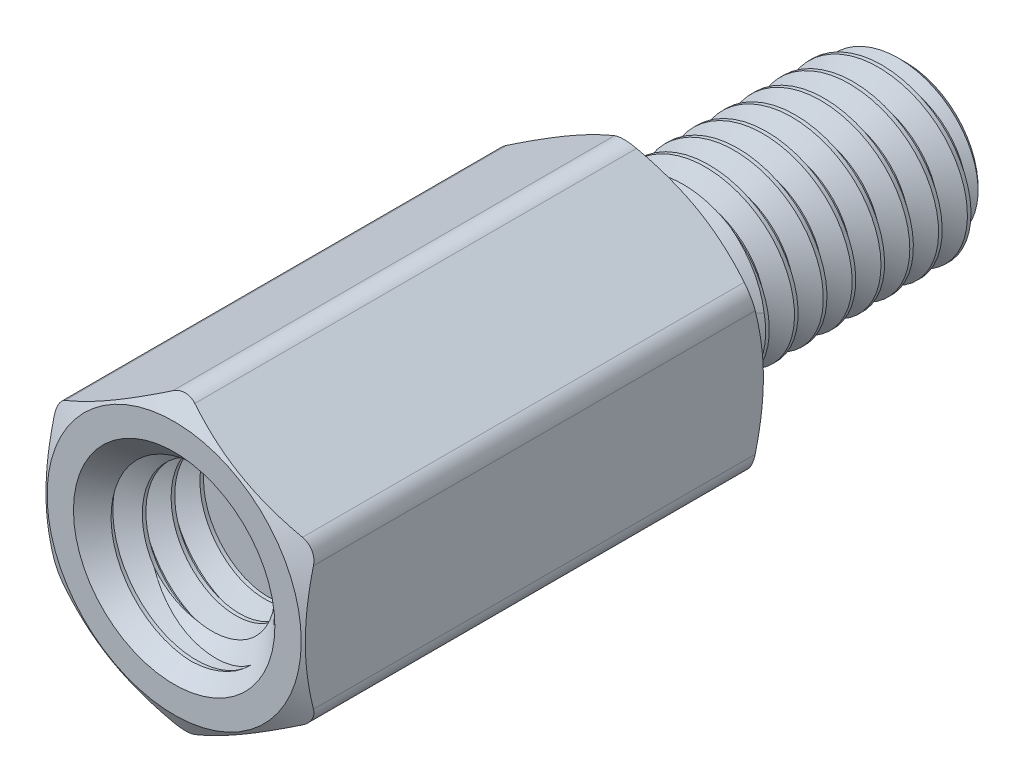
from build123d import *

# Parameters (mm, degrees)
SKETCH4_R           = 1.875
BOSS_EXTRUDE1_DEPTH = 8
SKETCH5_OUTSIDE_W   = 58.428
SKETCH5_OUTSIDE_H   = 59.124
SKETCH5_OUTSIDE_R   = 2.205
CUT_EXTRUDE1_DEPTH  = 14.156842326
CUT_EXTRUDE1_DRAFT  = -60
SKETCH6_OUTSIDE_W   = 43.014
SKETCH6_OUTSIDE_H   = 43.71
SKETCH6_OUTSIDE_R   = 2.205
CUT_EXTRUDE2_DEPTH  = 9.707037384
CUT_EXTRUDE2_DRAFT  = -60
FILLET1_R           = 0.3825
CUT_SWEEP1_PITCH    = 0.5
SKETCH9_R           = 1.75
BOSS_EXTRUDE2_DEPTH = 1.8
SKETCH10_W          = 1.8
SKETCH10_H          = 1.5
CUT_SWEEP2_PITCH    = 0.5


with BuildPart() as part:
    # Sketch3 → Revolve1 (revolve)
    with BuildSketch(Plane(origin=(0, 0, 0), x_dir=(0, 0, -1), z_dir=(1, 0, 0))):
        with BuildLine():
            Line((-6.2, 1.25), (-6.2, 0))
            Line((-6.2, 0), (4.7, 0))
            Line((4.7, 0), (4.7, 1.25))
            Line((4.7, 1.25), (4.45, 1.5))
            Line((4.45, 1.5), (0.7515, 1.5))
            Line((0.7515, 1.5), (0.564, 1.175240474))
            Line((0.564, 1.175240474), (0.25, 1.175240474))
            ThreePointArc((0.25, 1.175240474), (0.073223305, 1.248463778), (0, 1.425240474))
            Line((0, 1.425240474), (0, 2.25))
            Line((0, 2.25), (-8, 2.25))
            Line((-8, 2.25), (-8, 1.75))
            Line((-8, 1.75), (-7.75, 1.5))
            Line((-7.75, 1.5), (-6.45, 1.5))
            Line((-6.45, 1.5), (-6.2, 1.25))
        make_face()
    revolve(axis=Axis((0, 0, -4.7), (0, 0, 1)))

    # Sketch4 → Boss-Extrude1 (add)
    with BuildSketch(Plane.XY.offset(8)):
        Polygon((-2.25, 1.299038106), (-2.25, -1.299038106), (0, -2.598076211), (2.25, -1.299038106), (2.25, 1.299038106), (0, 2.598076211), align=None)
        Circle(SKETCH4_R, mode=Mode.SUBTRACT)
    extrude(amount=-BOSS_EXTRUDE1_DEPTH)


with BuildPart() as cut_extrude1_tool:
    # Sketch5 outside → Cut-Extrude1 (with draft: the straight prism first)
    with BuildSketch(Plane.XY.offset(8)):
        Rectangle(SKETCH5_OUTSIDE_W, SKETCH5_OUTSIDE_H)
        Circle(SKETCH5_OUTSIDE_R, mode=Mode.SUBTRACT)
    extrude(amount=-CUT_EXTRUDE1_DEPTH)
    # Cut-Extrude1: the draft: its side faces are tilted about the plane it starts from
    cut_extrude1_sides = [cut_extrude1_tool.faces().sort_by_distance(p)[0] for p in [
        (0, -29.562, 0.921578837),
        (29.214, 0, 0.921578837),
        (0, 29.562, 0.921578837),
        (-29.214, 0, 0.921578837),
        (-2.205, 0, 0.921578837),
    ]]
    draft(cut_extrude1_sides, Plane.XY.offset(8), CUT_EXTRUDE1_DRAFT)


with BuildPart() as part_1:
    add(part.part)

    # Cut-Extrude1: cut by cut_extrude1_tool
    add(cut_extrude1_tool.part, mode=Mode.SUBTRACT)


with BuildPart() as cut_extrude2_tool:
    # Sketch6 outside → Cut-Extrude2 (with draft: the straight prism first)
    with BuildSketch(Plane(origin=(0, 0, 0), x_dir=(-1, 0, 0), z_dir=(0, 0, -1))):
        Rectangle(SKETCH6_OUTSIDE_W, SKETCH6_OUTSIDE_H)
        Circle(SKETCH6_OUTSIDE_R, mode=Mode.SUBTRACT)
    extrude(amount=-CUT_EXTRUDE2_DEPTH)
    # Cut-Extrude2: the draft: its side faces are tilted about the plane it starts from
    cut_extrude2_sides = [cut_extrude2_tool.faces().sort_by_distance(p)[0] for p in [
        (0, -21.855, 4.853518692),
        (-21.507, 0, 4.853518692),
        (0, 21.855, 4.853518692),
        (21.507, 0, 4.853518692),
        (2.205, 0, 4.853518692),
    ]]
    draft(cut_extrude2_sides, Plane(origin=(0, 0, 0), x_dir=(-1, 0, 0), z_dir=(0, 0, -1)), CUT_EXTRUDE2_DRAFT)


with BuildPart() as part_2:
    add(part_1.part)

    # Cut-Extrude2: cut by cut_extrude2_tool
    add(cut_extrude2_tool.part, mode=Mode.SUBTRACT)

    # Fillet1
    fillet1_edges = [part_2.edges().sort_by_distance(p)[0] for p in [
        (0, 2.598076211, 4),
        (-2.25, -1.299038106, 4),
        (0, -2.598076211, 4),
        (2.25, -1.299038106, 4),
        (2.25, 1.299038106, 4),
        (-2.25, 1.299038106, 4),
    ]]
    fillet(fillet1_edges, radius=FILLET1_R)

    # Cut-Sweep1: the profile of Sketch7 profile screwed along a right-hand helix of 9.118 turns, 6 arcs to a turn; built about Z, then put on its axis
    cut_sweep1_z = Axis((0, 0, 0), (0, 0, 1))
    cut_sweep1_corners = [(1.174940474, 0, -0.187673205), (1.174940474, 0, -0.249826795), (1.527063294, 0, -0.453125), (1.527063294, 0, 0.015625)]
    with BuildLine(mode=Mode.PRIVATE) as cut_sweep1_profile:
        Line(cut_sweep1_corners[0], cut_sweep1_corners[1])
        Line(cut_sweep1_corners[1], cut_sweep1_corners[2])
        Line(cut_sweep1_corners[2], cut_sweep1_corners[3])
        Line(cut_sweep1_corners[3], cut_sweep1_corners[0])
    cut_sweep1_cap = Face(cut_sweep1_profile.wire())
    cut_sweep1_turn_angles = [0, 30, 60, 90, 120, 150, 180, 210, 240, 270, 300, 330, 360]
    cut_sweep1_turn_weights = [1, 0.8660254037844387, 1, 0.8660254037844387, 1, 0.8660254037844387, 1, 0.8660254037844387, 1, 0.8660254037844387, 1, 0.8660254037844387, 1]
    cut_sweep1_turn_rails = [Edge.make_bspline([Vector(p[0], p[1], 0).rotate(cut_sweep1_z, cut_sweep1_turn_angles[k]) / cut_sweep1_turn_weights[k] + Vector(0, 0, p[2] + CUT_SWEEP1_PITCH * cut_sweep1_turn_angles[k] / 360) for k in range(13)], [0, 0, 0, 1, 1, 2, 2, 3, 3, 4, 4, 5, 5, 6, 6, 6], 2, cut_sweep1_turn_weights) for p in cut_sweep1_corners]
    cut_sweep1_turn_sides = [Face.make_surface_from_curves(cut_sweep1_turn_rails[p[0]], cut_sweep1_turn_rails[p[1]]) for p in [(0, 1), (1, 2), (2, 3), (3, 0)]]
    cut_sweep1_last_angles = [3240, 3261.24, 3282.48]
    cut_sweep1_last_weights = [1, 0.9320711124581951, 1]
    cut_sweep1_last_rails = [Edge.make_bspline([Vector(p[0], p[1], 0).rotate(cut_sweep1_z, cut_sweep1_last_angles[k]) / cut_sweep1_last_weights[k] + Vector(0, 0, p[2] + CUT_SWEEP1_PITCH * cut_sweep1_last_angles[k] / 360) for k in range(3)], [0, 0, 0, 1, 1, 1], 2, cut_sweep1_last_weights) for p in cut_sweep1_corners]
    cut_sweep1_last_sides = [Face.make_surface_from_curves(cut_sweep1_last_rails[p[0]], cut_sweep1_last_rails[p[1]]) for p in [(0, 1), (1, 2), (2, 3), (3, 0)]]
    cut_sweep1 = Plane(origin=(0, 0, -4.7), x_dir=(0, 1, 0), z_dir=(0, 0, 1)) * Solid(Shell([*[p.moved(Location((0, 0, CUT_SWEEP1_PITCH * i))) for i in range(9) for p in cut_sweep1_turn_sides], *cut_sweep1_last_sides, cut_sweep1_cap, cut_sweep1_cap.rotate(cut_sweep1_z, 3282.48).moved(Location((0, 0, CUT_SWEEP1_PITCH * 3282.48 / 360)))]))
    add(cut_sweep1, mode=Mode.SUBTRACT)

    # Sketch9 → Boss-Extrude2 (add)
    with BuildSketch(Plane.XY.offset(6.2)):
        Circle(SKETCH9_R)
    extrude(amount=BOSS_EXTRUDE2_DEPTH)


with BuildPart() as body_2:
    # Sketch10 → Revolve2 (revolve)
    with BuildSketch(Plane(origin=(0, 0, 0), x_dir=(0, 0, -1), z_dir=(1, 0, 0))):
        with Locations((-7.1, 0.75)):
            Rectangle(SKETCH10_W, SKETCH10_H)
    revolve(axis=Axis((0, 0, -4.7), (0, 0, 1)))

    # Cut-Sweep2: the profile of Sketch12 profile screwed along a right-hand helix of 4.6 turns, 6 arcs to a turn; built about Z, then put on its axis
    cut_sweep2_z = Axis((0, 0, 0), (0, 0, 1))
    cut_sweep2_corners = [(1.174940474, 0, -0.249826795), (1.174940474, 0, -0.187673205), (1.527063294, 0, 0.015625), (1.527063294, 0, -0.453125)]
    with BuildLine(mode=Mode.PRIVATE) as cut_sweep2_profile:
        Line(cut_sweep2_corners[0], cut_sweep2_corners[1])
        Line(cut_sweep2_corners[1], cut_sweep2_corners[2])
        Line(cut_sweep2_corners[2], cut_sweep2_corners[3])
        Line(cut_sweep2_corners[3], cut_sweep2_corners[0])
    cut_sweep2_cap = Face(cut_sweep2_profile.wire())
    cut_sweep2_turn_angles = [0, 30, 60, 90, 120, 150, 180, 210, 240, 270, 300, 330, 360]
    cut_sweep2_turn_weights = [1, 0.8660254037844387, 1, 0.8660254037844387, 1, 0.8660254037844387, 1, 0.8660254037844387, 1, 0.8660254037844387, 1, 0.8660254037844387, 1]
    cut_sweep2_turn_rails = [Edge.make_bspline([Vector(p[0], p[1], 0).rotate(cut_sweep2_z, cut_sweep2_turn_angles[k]) / cut_sweep2_turn_weights[k] + Vector(0, 0, p[2] + CUT_SWEEP2_PITCH * cut_sweep2_turn_angles[k] / 360) for k in range(13)], [0, 0, 0, 1, 1, 2, 2, 3, 3, 4, 4, 5, 5, 6, 6, 6], 2, cut_sweep2_turn_weights) for p in cut_sweep2_corners]
    cut_sweep2_turn_sides = [Face.make_surface_from_curves(cut_sweep2_turn_rails[p[0]], cut_sweep2_turn_rails[p[1]]) for p in [(0, 1), (1, 2), (2, 3), (3, 0)]]
    cut_sweep2_last_angles = [1440, 1470, 1500, 1530, 1560, 1590, 1620, 1638, 1656]
    cut_sweep2_last_weights = [1, 0.8660254037844387, 1, 0.8660254037844387, 1, 0.8660254037844387, 1, 0.9510565162951523, 1]
    cut_sweep2_last_rails = [Edge.make_bspline([Vector(p[0], p[1], 0).rotate(cut_sweep2_z, cut_sweep2_last_angles[k]) / cut_sweep2_last_weights[k] + Vector(0, 0, p[2] + CUT_SWEEP2_PITCH * cut_sweep2_last_angles[k] / 360) for k in range(9)], [0, 0, 0, 1, 1, 2, 2, 3, 3, 4, 4, 4], 2, cut_sweep2_last_weights) for p in cut_sweep2_corners]
    cut_sweep2_last_sides = [Face.make_surface_from_curves(cut_sweep2_last_rails[p[0]], cut_sweep2_last_rails[p[1]]) for p in [(0, 1), (1, 2), (2, 3), (3, 0)]]
    cut_sweep2 = Plane(origin=(0, 0, 8), x_dir=(0, 1, 0), z_dir=(0, 0, -1)) * Solid(Shell([*[p.moved(Location((0, 0, CUT_SWEEP2_PITCH * i))) for i in range(4) for p in cut_sweep2_turn_sides], *cut_sweep2_last_sides, cut_sweep2_cap, cut_sweep2_cap.rotate(cut_sweep2_z, 1656).moved(Location((0, 0, CUT_SWEEP2_PITCH * 1656 / 360)))]))
    add(cut_sweep2, mode=Mode.SUBTRACT)


with BuildPart() as part_3:
    add(part_2.part)

    # Combine1: cut body 2
    add(body_2.part, mode=Mode.SUBTRACT)

    # Cut-Extrude3 cone 1 section (through the dimple's axis) → Cut-Extrude3 (revolve, cut)
    with BuildSketch(Plane(origin=(0, 0, 8), x_dir=(0, -1, 0), z_dir=(1, 0, 0))):
        Polygon((0, 0), (1.7475, 0), (0, 1.7475), align=None)
    revolve(axis=Axis((0, 0, 8), (0, 0, -1)), mode=Mode.SUBTRACT)


solid = part_3.part
